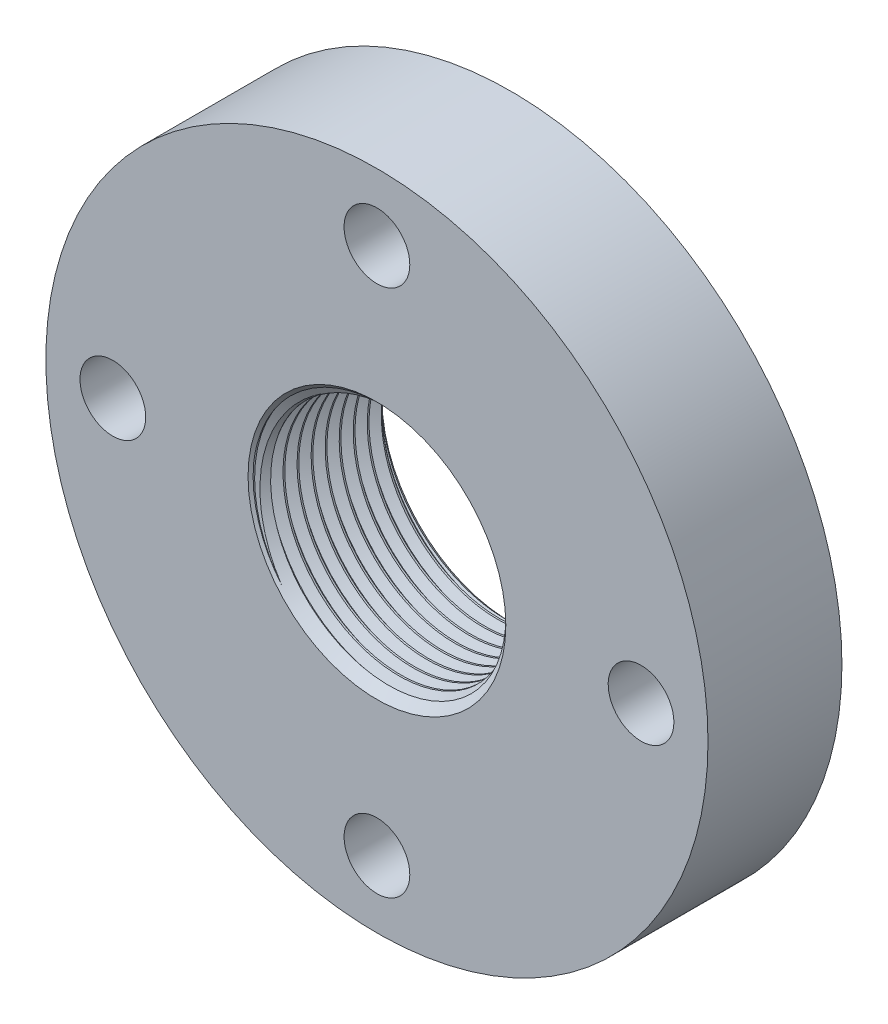
from build123d import *

# Parameters (mm, degrees)
SKETCH1_R           = 33.274
BOSS_EXTRUDE1_DEPTH = 13.462
SKETCH2_R           = 12.7
BOSS_EXTRUDE2_DEPTH = 13.462
SKETCH5_R           = 3.302
CUT_EXTRUDE1_DEPTH  = 13.462
CIRPATTERN1_COUNT   = 4
CUT_SWEEP1_PITCH    = 1.411111111
SKETCH6_R           = 12.954
CUT_EXTRUDE2_DEPTH  = 2.54
CUT_EXTRUDE2_TAPER  = 45


with BuildPart() as part:
    # Sketch1 → Boss-Extrude1 (new body)
    with BuildSketch(Plane.XY):
        Circle(SKETCH1_R)
    extrude(amount=BOSS_EXTRUDE1_DEPTH)

    # Sketch5 → Cut-Extrude1 (cut)
    with BuildSketch(Plane.XY):
        with Locations((0, 26.543)):
            Circle(SKETCH5_R)
    cut_extrude1 = extrude(amount=CUT_EXTRUDE1_DEPTH, mode=Mode.SUBTRACT)

    # CirPattern1: Cut-Extrude1 ×4 about axis
    cirpattern1_axis = Axis((0, 0, 0), (0, 0, 1))
    for i in range(1, CIRPATTERN1_COUNT):
        add(cut_extrude1.rotate(cirpattern1_axis, i * 360 / CIRPATTERN1_COUNT), mode=Mode.SUBTRACT)


with BuildPart() as body_2:
    # Sketch2 → Boss-Extrude2 (new body)
    with BuildSketch(Plane.XY):
        Circle(SKETCH2_R)
    extrude(amount=BOSS_EXTRUDE2_DEPTH)

    # Cut-Sweep1: the profile of Sketch3 profile screwed along a right-hand helix of 11.79 turns, 8 arcs to a turn; built about Z, then put on its axis
    cut_sweep1_z = Axis((0, 0, 0), (0, 0, 1))
    cut_sweep1_corners = [(8.980468253, 8.980468253, 0.000173205), (8.980468253, 8.980468253, -1.234895427), (8.33216196, 8.33216196, -0.705555556), (8.33216196, 8.33216196, -0.529166667)]
    with BuildLine(mode=Mode.PRIVATE) as cut_sweep1_profile:
        Line(cut_sweep1_corners[0], cut_sweep1_corners[1])
        Line(cut_sweep1_corners[1], cut_sweep1_corners[2])
        Line(cut_sweep1_corners[2], cut_sweep1_corners[3])
        Line(cut_sweep1_corners[3], cut_sweep1_corners[0])
    cut_sweep1_cap = Face(cut_sweep1_profile.wire())
    cut_sweep1_turn_angles = [0, 22.5, 45, 67.5, 90, 112.5, 135, 157.5, 180, 202.5, 225, 247.5, 270, 292.5, 315, 337.5, 360]
    cut_sweep1_turn_weights = [1, 0.9238795325112867, 1, 0.9238795325112867, 1, 0.9238795325112867, 1, 0.9238795325112867, 1, 0.9238795325112867, 1, 0.9238795325112867, 1, 0.9238795325112867, 1, 0.9238795325112867, 1]
    cut_sweep1_turn_rails = [Edge.make_bspline([Vector(p[0], p[1], 0).rotate(cut_sweep1_z, cut_sweep1_turn_angles[k]) / cut_sweep1_turn_weights[k] + Vector(0, 0, p[2] + CUT_SWEEP1_PITCH * cut_sweep1_turn_angles[k] / 360) for k in range(17)], [0, 0, 0, 1, 1, 2, 2, 3, 3, 4, 4, 5, 5, 6, 6, 7, 7, 8, 8, 8], 2, cut_sweep1_turn_weights) for p in cut_sweep1_corners]
    cut_sweep1_turn_sides = [Face.make_surface_from_curves(cut_sweep1_turn_rails[p[0]], cut_sweep1_turn_rails[p[1]]) for p in [(0, 1), (1, 2), (2, 3), (3, 0)]]
    cut_sweep1_last_angles = [3960, 3982.5, 4005, 4027.5, 4050, 4072.5, 4095, 4117.5, 4140, 4162.5, 4185, 4207.5, 4230, 4237.2, 4244.4]
    cut_sweep1_last_weights = [1, 0.9238795325112867, 1, 0.9238795325112867, 1, 0.9238795325112867, 1, 0.9238795325112867, 1, 0.9238795325112867, 1, 0.9238795325112867, 1, 0.9921147013144643, 1]
    cut_sweep1_last_rails = [Edge.make_bspline([Vector(p[0], p[1], 0).rotate(cut_sweep1_z, cut_sweep1_last_angles[k]) / cut_sweep1_last_weights[k] + Vector(0, 0, p[2] + CUT_SWEEP1_PITCH * cut_sweep1_last_angles[k] / 360) for k in range(15)], [0, 0, 0, 1, 1, 2, 2, 3, 3, 4, 4, 5, 5, 6, 6, 7, 7, 7], 2, cut_sweep1_last_weights) for p in cut_sweep1_corners]
    cut_sweep1_last_sides = [Face.make_surface_from_curves(cut_sweep1_last_rails[p[0]], cut_sweep1_last_rails[p[1]]) for p in [(0, 1), (1, 2), (2, 3), (3, 0)]]
    cut_sweep1 = Plane(origin=(0, 0, 0), x_dir=(0.7071067811865464, 0.7071067811865488, 0), z_dir=(0, 0, 1)) * Solid(Shell([*[p.moved(Location((0, 0, CUT_SWEEP1_PITCH * i))) for i in range(11) for p in cut_sweep1_turn_sides], *cut_sweep1_last_sides, cut_sweep1_cap, cut_sweep1_cap.rotate(cut_sweep1_z, 4244.4).moved(Location((0, 0, CUT_SWEEP1_PITCH * 4244.4 / 360)))]))
    add(cut_sweep1, mode=Mode.SUBTRACT)


with BuildPart() as part_1:
    add(part.part)

    # Combine1: cut body 2
    add(body_2.part, mode=Mode.SUBTRACT)

    # Sketch6 → Cut-Extrude2 (cut)
    with BuildSketch(Plane.XY):
        Circle(SKETCH6_R)
    cut_extrude2 = extrude(amount=CUT_EXTRUDE2_DEPTH, taper=CUT_EXTRUDE2_TAPER, mode=Mode.SUBTRACT)

    # Mirror1: Cut-Extrude2 across plane
    add(cut_extrude2.mirror(Plane(origin=(0, 0, 6.731), x_dir=(1, 0, 0), z_dir=(0, 0, -1))), mode=Mode.SUBTRACT)


solid = part_1.part
